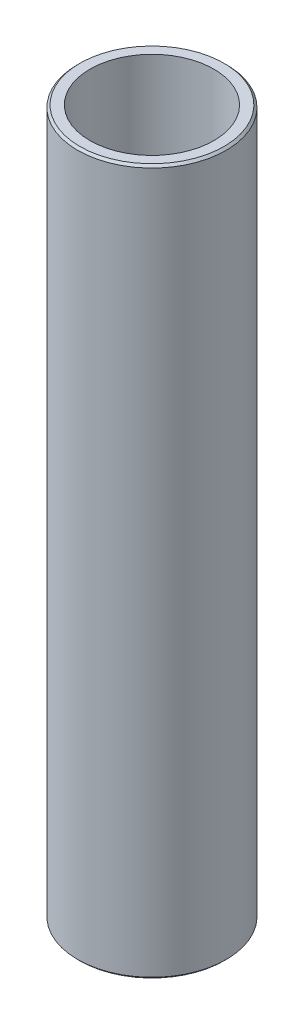
from build123d import *

# Parameters (mm, degrees)
SKETCH1_R           = 42.5
BOSS_EXTRUDE1_DEPTH = 403.305592901
SKETCH2_R           = 35.442201655
CUT_EXTRUDE1_DEPTH  = 408.759612106
CHAMFER1_SIZE       = 1.26669931


with BuildPart() as part:
    # Sketch1 → Boss-Extrude1 (new body)
    with BuildSketch(Plane(origin=(0, 0, 0), x_dir=(1, 0, 0), z_dir=(0, 1, 0))):
        Circle(SKETCH1_R)
    extrude(amount=BOSS_EXTRUDE1_DEPTH)

    # Sketch2 → Cut-Extrude1 (cut, through all)
    with BuildSketch(Plane(origin=(0, 0, 0), x_dir=(1, 0, 0), z_dir=(0, 1, 0))):
        Circle(SKETCH2_R)
    extrude(amount=CUT_EXTRUDE1_DEPTH, mode=Mode.SUBTRACT)

    # Chamfer1
    chamfer1_edges = [part.edges().sort_by_distance(p)[0] for p in [
        (-42.5, 403.305592901, 0),
        (-42.5, 0, 0),
    ]]
    chamfer(chamfer1_edges, length=CHAMFER1_SIZE)


solid = part.part
